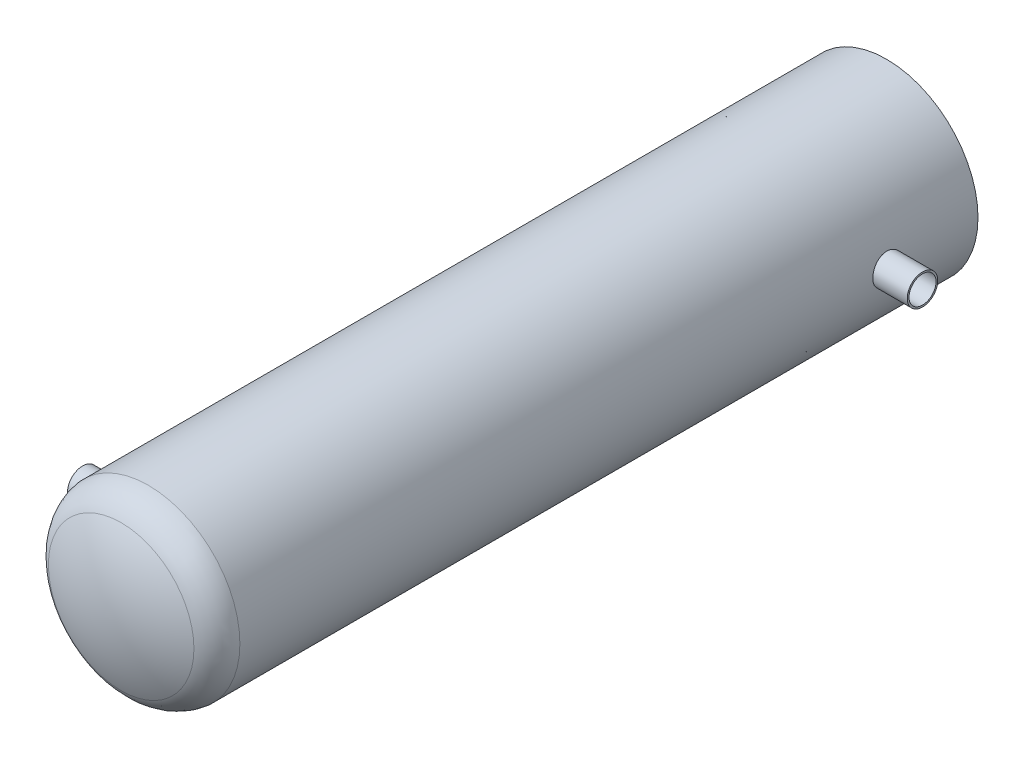
from build123d import *

# Parameters (mm, degrees)
SKETCH1_R           = 305
SKETCH1_R_2         = 287.52
BOSS_EXTRUDE1_DEPTH = 2410
SKETCH3_W           = 120
SKETCH3_H           = 5.74
SKETCH4_W           = 120
SKETCH4_H           = 5.74
SKETCH5_R           = 45.06
CUT_EXTRUDE1_DEPTH  = 366
SKETCH6_R           = 45.06
CUT_EXTRUDE2_DEPTH  = 366


with BuildPart() as part:
    # Sketch1 → Boss-Extrude1 (new body)
    with BuildSketch(Plane.XY):
        Circle(SKETCH1_R)
        Circle(SKETCH1_R_2, mode=Mode.SUBTRACT)
    extrude(amount=BOSS_EXTRUDE1_DEPTH)

    # Sketch2 → Revolve1 (revolve)
    with BuildSketch(Plane(origin=(0, 0, 0), x_dir=(1, 0, 0), z_dir=(0, 1, 0))):
        with BuildLine():
            Line((287.52, -2410), (287.52, -2460))
            ThreePointArc((287.52, -2460), (270.731420067, -2504.780446806), (234.708977843, -2536.23721855))
            ThreePointArc((234.708977843, -2536.23721855), (120.681456496, -2578.252642124), (0, -2592.52))
            Line((0, -2592.52), (0, -2610))
            ThreePointArc((0, -2610), (124.757571619, -2595.250750416), (242.636465974, -2551.816221468))
            ThreePointArc((242.636465974, -2551.816221468), (285.388930418, -2514.315997098), (305, -2460.935794835))
            Line((305, -2460.935794835), (305, -2410))
            Line((305, -2410), (287.52, -2410))
        make_face()
    revolve(axis=Axis((0, 0, 0), (0, 0, 1)))

    # Sketch5 → Cut-Extrude1 (cut)
    with BuildSketch(Plane(origin=(420, 0, 0), x_dir=(0, 0, -1), z_dir=(1, 0, 0))):
        with Locations((-300, 0)):
            Circle(SKETCH5_R)
    extrude(amount=-CUT_EXTRUDE1_DEPTH, mode=Mode.SUBTRACT)

    # Sketch6 → Cut-Extrude2 (cut)
    with BuildSketch(Plane.ZY.offset(420)):
        with Locations((2260, 0)):
            Circle(SKETCH6_R)
    extrude(amount=-CUT_EXTRUDE2_DEPTH, mode=Mode.SUBTRACT)


with BuildPart() as body_2:
    # Sketch3 → Revolve2 (revolve)
    with BuildSketch(Plane(origin=(0, 0, 0), x_dir=(1, 0, 0), z_dir=(0, 1, 0))):
        with Locations((360, -252.07)):
            Rectangle(SKETCH3_W, SKETCH3_H)
    revolve(axis=Axis((305, 0, 300), (1, 0, 0)))


with BuildPart() as body_3:
    # Sketch4 → Revolve3 (revolve)
    with BuildSketch(Plane(origin=(0, 0, 0), x_dir=(1, 0, 0), z_dir=(0, 1, 0))):
        with Locations((-360, -2212.07)):
            Rectangle(SKETCH4_W, SKETCH4_H)
    revolve(axis=Axis((-305, 0, 2260), (-1, 0, 0)))


solid = Compound([part.part, body_2.part, body_3.part])
